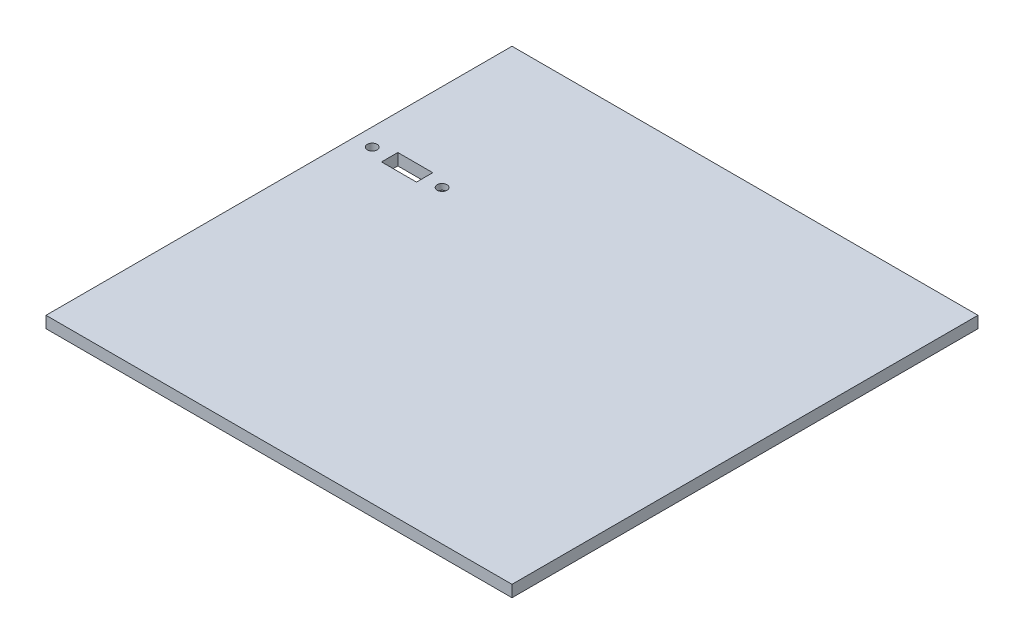
from build123d import *

# Parameters (mm, degrees)
SKETCH1_W           = 200
SKETCH1_H           = 200
BOSS_EXTRUDE1_DEPTH = 5
SKETCH3_W           = 118
SKETCH3_H           = 118
BOSS_EXTRUDE2_DEPTH = 4
SKETCH4_R           = 2.4
CUT_EXTRUDE1_DEPTH  = 8
CUT_EXTRUDE3_START  = -2
CUT_EXTRUDE3_DEPTH  = 3.6
SKETCH6_W           = 45
SKETCH6_H           = 7
CUT_EXTRUDE2_DEPTH  = 6.5
SKETCH8_W           = 15
SKETCH8_H           = 7
CUT_EXTRUDE4_DEPTH  = 142.707445111
SKETCH9_R           = 2.1
CUT_EXTRUDE5_DEPTH  = 142.509716981


with BuildPart() as part:
    # Sketch1 → Boss-Extrude1 (new body)
    with BuildSketch(Plane(origin=(0, 0, 0), x_dir=(1, 0, 0), z_dir=(0, 1, 0))):
        Rectangle(SKETCH1_W, SKETCH1_H)
    extrude(amount=BOSS_EXTRUDE1_DEPTH)

    # Sketch3 → Boss-Extrude2 (add)
    with BuildSketch(Plane.XZ):
        Rectangle(SKETCH3_W, SKETCH3_H)
    extrude(amount=BOSS_EXTRUDE2_DEPTH)

    # Sketch4 → Cut-Extrude1 (cut)
    with BuildSketch(Plane.XZ.offset(4)):
        with Locations((50, -50)):
            Circle(SKETCH4_R)
        with Locations((-50, -50)):
            Circle(SKETCH4_R)
        with Locations((-50, 50)):
            Circle(SKETCH4_R)
        with Locations((50, 50)):
            Circle(SKETCH4_R)
    extrude(amount=-CUT_EXTRUDE1_DEPTH, mode=Mode.SUBTRACT)

    # Sketch7 → Cut-Extrude3 (cut)
    with BuildSketch(Plane.XZ.offset(4).offset(CUT_EXTRUDE3_START)):
        Polygon((50, 54.272391992), (46.3, 52.136195996), (46.3, 47.863804004), (50, 45.727608008), (53.7, 47.863804004), (53.7, 52.136195996), align=None)
        Polygon((-50, 54.272391992), (-53.7, 52.136195996), (-53.7, 47.863804004), (-50, 45.727608008), (-46.3, 47.863804004), (-46.3, 52.136195996), align=None)
        Polygon((50, -45.727608008), (46.3, -47.863804004), (46.3, -52.136195996), (50, -54.272391992), (53.7, -52.136195996), (53.7, -47.863804004), align=None)
        Polygon((-50, -45.727608008), (-53.7, -47.863804004), (-53.7, -52.136195996), (-50, -54.272391992), (-46.3, -52.136195996), (-46.3, -47.863804004), align=None)
    extrude(amount=-CUT_EXTRUDE3_DEPTH, mode=Mode.SUBTRACT)

    # Sketch6 → Cut-Extrude2 (cut)
    with BuildSketch(Plane.XZ.offset(4)):
        with Locations((-62.5, -32.5)):
            Rectangle(SKETCH6_W, SKETCH6_H)
    extrude(amount=-CUT_EXTRUDE2_DEPTH, mode=Mode.SUBTRACT)

    # Sketch8 → Cut-Extrude4 (cut, through all)
    with BuildSketch(Plane(origin=(0, 5, 0), x_dir=(1, 0, 0), z_dir=(0, 1, 0))):
        with Locations((-77.5, 32.5)):
            Rectangle(SKETCH8_W, SKETCH8_H)
    extrude(amount=-CUT_EXTRUDE4_DEPTH, mode=Mode.SUBTRACT)

    # Sketch9 → Cut-Extrude5 (cut, through all)
    with BuildSketch(Plane.XZ):
        with Locations((-62.5, -32.5)):
            Circle(SKETCH9_R)
        with Locations((-92.5, -32.5)):
            Circle(SKETCH9_R)
    extrude(amount=-CUT_EXTRUDE5_DEPTH, mode=Mode.SUBTRACT)


solid = part.part
